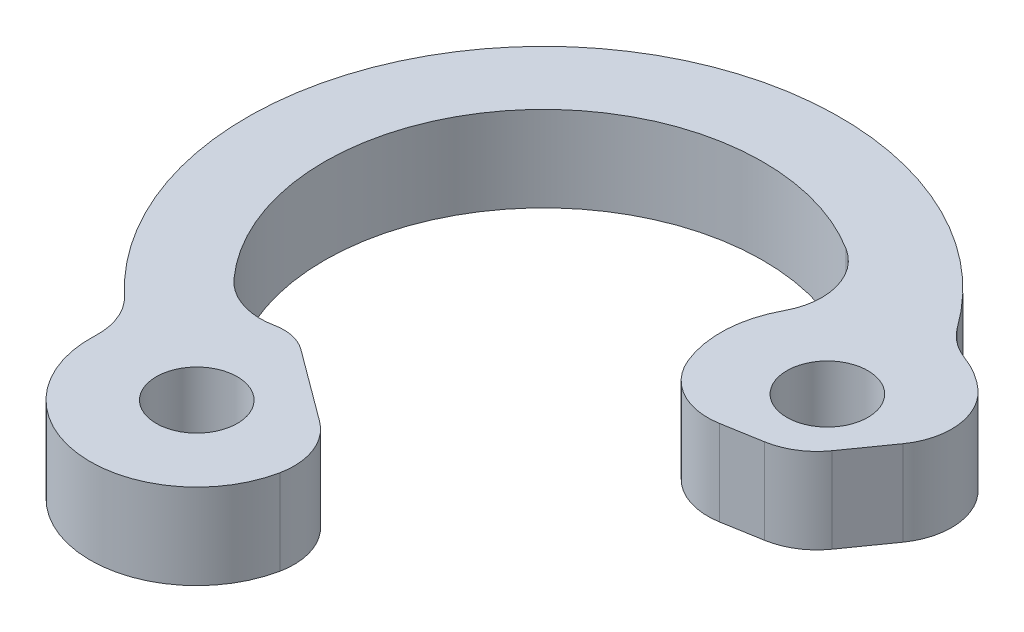
from build123d import *

# Parameters (mm, degrees)
SKETCH2_R           = 1.9
BOSS_EXTRUDE1_DEPTH = 4
FILLET1_R           = 3
CUT_EXTRUDE2_DEPTH  = 7
FILLET2_R           = 3
FILLET3_R           = 2
CUT_EXTRUDE3_DEPTH  = 4
FILLET4_R           = 3
CUT_EXTRUDE4_DEPTH  = 5
FILLET5_R           = 3


with BuildPart() as part:
    # Sketch2 → Boss-Extrude1 (new body)
    with BuildSketch(Plane(origin=(0, 0, 0), x_dir=(1, 0, 0), z_dir=(0, 1, 0))):
        with BuildLine():
            ThreePointArc((70.082441242, 70.375471459), (68.701032678, 85.785425288), (84.157953122, 85.10824213))
            ThreePointArc((84.157953122, 85.10824213), (88.169530247, 76.167900978), (87.971523368, 85.965004847))
            ThreePointArc((87.971523368, 85.965004847), (66.773130519, 88.957801307), (67.785886209, 67.573156911))
            ThreePointArc((67.785886209, 67.573156911), (76.405902982, 62.851068524), (70.082441242, 70.375471459))
        make_face()
        with Locations((72.538655529, 66.020358214)):
            Circle(SKETCH2_R, mode=Mode.SUBTRACT)
        with Locations((87.073540725, 81.04630307)):
            Circle(SKETCH2_R, mode=Mode.SUBTRACT)
    extrude(amount=BOSS_EXTRUDE1_DEPTH)

    # Fillet1
    fillet1_edges = [part.edges().sort_by_distance(p)[0] for p in [
        (67.785886209, 2, -67.573156911),
        (70.082441242, 2, -70.375471459),
        (84.157953122, 2, -85.10824213),
        (87.971523368, 2, -85.965004847),
    ]]
    fillet(fillet1_edges, radius=FILLET1_R)

    # Sketch4 → Cut-Extrude2 (cut)
    with BuildSketch(Plane(origin=(0, 0, 0), x_dir=(-1, 0, 0), z_dir=(0, -1, 0))):
        Polygon((-78.063653069, 66.716653157), (-72.1449642, 71.091471725), (-73.077184563, 72.352671977), (-78.995873431, 67.977853409), align=None)
    extrude(amount=-CUT_EXTRUDE2_DEPTH, mode=Mode.SUBTRACT)

    # Fillet2
    fillet2_edges = [part.edges().sort_by_distance(p)[0] for p in [
        (77.394817884, 2, -67.211024909),
    ]]
    fillet(fillet2_edges, radius=FILLET2_R)

    # Fillet3
    fillet3_edges = [part.edges().sort_by_distance(p)[0] for p in [
        (72.252278132, 2, -71.012150275),
    ]]
    fillet(fillet3_edges, radius=FILLET3_R)

    # Sketch5 → Cut-Extrude3 (cut)
    with BuildSketch(Plane(origin=(0, 4, 0), x_dir=(1, 0, 0), z_dir=(0, 1, 0))):
        Polygon((91.915683274, 82.292760262), (87.509474915, 76.065343184), (89.248604191, 74.615528375), (94.045863103, 81.084803637), align=None)
    extrude(amount=-CUT_EXTRUDE3_DEPTH, mode=Mode.SUBTRACT)

    # Fillet4
    fillet4_edges = [part.edges().sort_by_distance(p)[0] for p in [
        (87.509474915, 2, -76.065343184),
        (91.915683274, 2, -82.292760262),
    ]]
    fillet(fillet4_edges, radius=FILLET4_R)

    # Sketch6 → Cut-Extrude4 (cut)
    with BuildSketch(Plane(origin=(0, 4, 0), x_dir=(1, 0, 0), z_dir=(0, 1, 0))):
        Polygon((88.770033289, 77.846925466), (84.083019815, 77.039211271), (84.659332186, 75.34612768), (89.090596179, 75.986759337), align=None)
    extrude(amount=-CUT_EXTRUDE4_DEPTH, mode=Mode.SUBTRACT)

    # Fillet5
    fillet5_edges = [part.edges().sort_by_distance(p)[0] for p in [
        (84.083019815, 2, -77.039211271),
        (88.770033289, 2, -77.846925466),
    ]]
    fillet(fillet5_edges, radius=FILLET5_R)


solid = part.part
